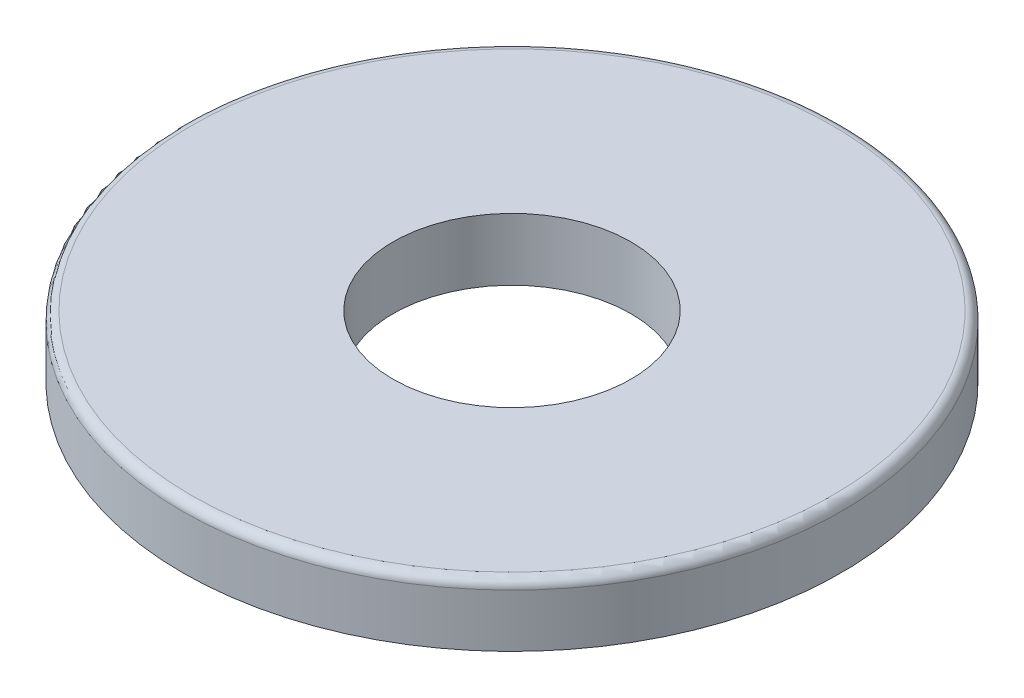
from build123d import *

# Parameters (mm, degrees)
SKETCH_1_R      = 9
SKETCH_1_R_2    = 3.25
EXTRUDE_1_DEPTH = 1.7
FILLET_1_R      = 0.25


with BuildPart() as part:
    # Эскиз1 → Вытянуть1 (new body)
    with BuildSketch(Plane(origin=(0, 0, 0), x_dir=(1, 0, 0), z_dir=(0, 1, 0))):
        Circle(SKETCH_1_R)
        Circle(SKETCH_1_R_2, mode=Mode.SUBTRACT)
    extrude(amount=EXTRUDE_1_DEPTH)

    # Скругление1
    fillet_1_edges = [part.edges().sort_by_distance(p)[0] for p in [
        (-9, 1.7, 0),
    ]]
    fillet(fillet_1_edges, radius=FILLET_1_R)


solid = part.part
